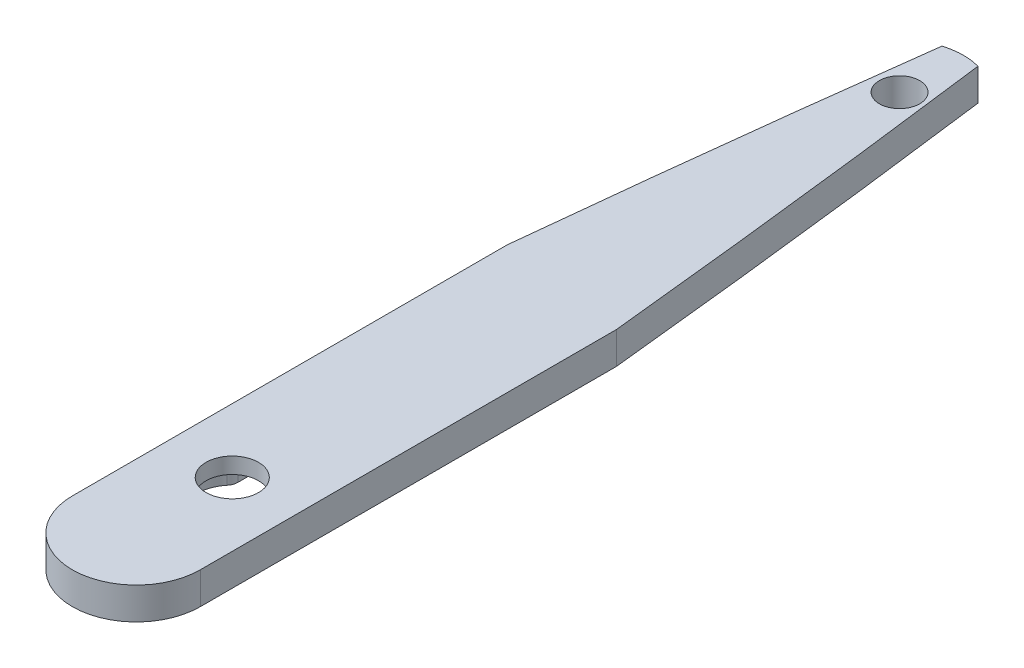
from build123d import *

# Parameters (mm, degrees)
SKETCH1_W           = 15
SKETCH1_H           = 45
BOSS_EXTRUDE1_DEPTH = 2.2
SKETCH1_3_W         = 20
SKETCH1_3_H         = 50
SKETCH1_3_W_2       = 15
SKETCH1_3_H_2       = 45
BOSS_EXTRUDE2_DEPTH = 2.5
SKETCH1_4_W         = 20
SKETCH1_4_H         = 50
SKETCH1_4_R         = 4.1
BOSS_EXTRUDE3_DEPTH = 2.5
FILLET1_R           = 2
SKETCH1_5_R         = 3.15
BOSS_EXTRUDE4_DEPTH = 2.5
FILLET2_R           = 10
SKETCH2_R           = 3.15
CUT_EXTRUDE1_DEPTH  = 4
SKETCH3_OUTSIDE_W   = 50.164
SKETCH3_OUTSIDE_H   = 169.464
CUT_EXTRUDE2_DEPTH  = 115.845504919


with BuildPart() as part:
    # Sketch1 → Boss-Extrude1 (new body)
    with BuildSketch(Plane(origin=(0, 0, 0), x_dir=(1, 0, 0), z_dir=(0, 1, 0))):
        Rectangle(SKETCH1_W, SKETCH1_H)
        with BuildLine():
            ThreePointArc((-3.894544437, -4.023993492), (-5.599998379, 0.004260474), (-3.88841703, 4.029914763))
            Line((-3.88841703, 4.029914763), (-3.88841703, 8.505312122))
            ThreePointArc((-3.88841703, 8.505312122), (-3.870707724, 8.925763598), (-3.817705253, 9.343236712))
            Line((-3.817705253, 9.343236712), (-2.664584371, 16.126741161))
            ThreePointArc((-2.664584371, 16.126741161), (-2.610617779, 16.555799687), (-2.593926654, 16.987916591))
            ThreePointArc((-2.593926654, 16.987916591), (0, 19.6), (2.606045235, 17.000007028))
            ThreePointArc((2.606045235, 17.000007028), (2.623754541, 16.579555552), (2.676757012, 16.162082438))
            Line((2.676757012, 16.162082438), (3.829877895, 9.378577989))
            ThreePointArc((3.829877895, 9.378577989), (3.882880366, 8.961104875), (3.900589672, 8.540653399))
            Line((3.900589672, 8.540653399), (3.900589672, 4.018133922))
            ThreePointArc((3.900589672, 4.018133922), (5.157678846, 2.181364004), (5.6, 0))
            ThreePointArc((5.6, 0), (5.156037667, -2.185240393), (3.894544437, -4.023993492))
            Line((3.894544437, -4.023993492), (3.894544437, -8.540646372))
            ThreePointArc((3.894544437, -8.540646372), (3.876835131, -8.961097847), (3.82383266, -9.378570962))
            Line((3.82383266, -9.378570962), (2.670711777, -16.16207541))
            ThreePointArc((2.670711777, -16.16207541), (2.617709306, -16.579548524), (2.6, -17))
            ThreePointArc((2.6, -17), (0, -19.6), (-2.6, -17))
            ThreePointArc((-2.6, -17), (-2.617709306, -16.579548524), (-2.670711777, -16.16207541))
            Line((-2.670711777, -16.16207541), (-3.82383266, -9.378570962))
            ThreePointArc((-3.82383266, -9.378570962), (-3.876835131, -8.961097847), (-3.894544437, -8.540646372))
            Line((-3.894544437, -8.540646372), (-3.894544437, -4.023993492))
        make_face(mode=Mode.SUBTRACT)
    extrude(amount=-BOSS_EXTRUDE1_DEPTH)

    # Sketch1<3> → Boss-Extrude2 (add)
    # profile 1 of 2: a face of its own
    with BuildSketch(Plane(origin=(0, 0, 0), x_dir=(1, 0, 0), z_dir=(0, 1, 0))):
        Rectangle(SKETCH1_3_W, SKETCH1_3_H)
        Rectangle(SKETCH1_3_W_2, SKETCH1_3_H_2, mode=Mode.SUBTRACT)
    # profile 2 of 2: a face of its own
    with BuildSketch(Plane(origin=(0, 0, 0), x_dir=(1, 0, 0), z_dir=(0, 1, 0))):
        Rectangle(SKETCH1_3_W_2, SKETCH1_3_H_2)
        with BuildLine():
            ThreePointArc((-3.894544437, -4.023993492), (-5.599998379, 0.004260474), (-3.88841703, 4.029914763))
            Line((-3.88841703, 4.029914763), (-3.88841703, 8.505312122))
            ThreePointArc((-3.88841703, 8.505312122), (-3.870707724, 8.925763598), (-3.817705253, 9.343236712))
            Line((-3.817705253, 9.343236712), (-2.664584371, 16.126741161))
            ThreePointArc((-2.664584371, 16.126741161), (-2.610617779, 16.555799687), (-2.593926654, 16.987916591))
            ThreePointArc((-2.593926654, 16.987916591), (0, 19.6), (2.606045235, 17.000007028))
            ThreePointArc((2.606045235, 17.000007028), (2.623754541, 16.579555552), (2.676757012, 16.162082438))
            Line((2.676757012, 16.162082438), (3.829877895, 9.378577989))
            ThreePointArc((3.829877895, 9.378577989), (3.882880366, 8.961104875), (3.900589672, 8.540653399))
            Line((3.900589672, 8.540653399), (3.900589672, 4.018133922))
            ThreePointArc((3.900589672, 4.018133922), (5.157678846, 2.181364004), (5.6, 0))
            ThreePointArc((5.6, 0), (5.156037667, -2.185240393), (3.894544437, -4.023993492))
            Line((3.894544437, -4.023993492), (3.894544437, -8.540646372))
            ThreePointArc((3.894544437, -8.540646372), (3.876835131, -8.961097847), (3.82383266, -9.378570962))
            Line((3.82383266, -9.378570962), (2.670711777, -16.16207541))
            ThreePointArc((2.670711777, -16.16207541), (2.617709306, -16.579548524), (2.6, -17))
            ThreePointArc((2.6, -17), (0, -19.6), (-2.6, -17))
            ThreePointArc((-2.6, -17), (-2.617709306, -16.579548524), (-2.670711777, -16.16207541))
            Line((-2.670711777, -16.16207541), (-3.82383266, -9.378570962))
            ThreePointArc((-3.82383266, -9.378570962), (-3.876835131, -8.961097847), (-3.894544437, -8.540646372))
            Line((-3.894544437, -8.540646372), (-3.894544437, -4.023993492))
        make_face(mode=Mode.SUBTRACT)
    extrude(amount=-BOSS_EXTRUDE2_DEPTH)

    # Sketch1<4> → Boss-Extrude3 (add)
    with BuildSketch(Plane(origin=(0, 0, 0), x_dir=(1, 0, 0), z_dir=(0, 1, 0))):
        Rectangle(SKETCH1_4_W, SKETCH1_4_H)
        with Locations(Location((0, 0, 0), (0, 0, 270))):
            Circle(SKETCH1_4_R, mode=Mode.SUBTRACT)
    extrude(amount=BOSS_EXTRUDE3_DEPTH)

    # Fillet1
    fillet1_edges = [part.edges().sort_by_distance(p)[0] for p in [
        (-3.88841703, -1.25, -4.029914763),
        (-3.894544437, -1.25, 4.023993492),
        (3.894544437, -1.25, 4.023993492),
        (3.900589672, -1.25, -4.018133922),
    ]]
    fillet(fillet1_edges, radius=FILLET1_R)

    # Sketch1<5> → Boss-Extrude4 (add, symmetric)
    with BuildSketch(Plane(origin=(0, 0, 0), x_dir=(1, 0, 0), z_dir=(0, 1, 0))):
        with BuildLine():
            ThreePointArc((-10, 104.3), (0, 114.3), (10, 104.3))
            Line((10, 104.3), (10, 25))
            Line((10, 25), (-10, 25))
            Line((-10, 25), (-10, 104.3))
        make_face()
        with Locations(Location((0, 104.3, 0), (0, 0, 270))):
            Circle(SKETCH1_5_R, mode=Mode.SUBTRACT)
    extrude(amount=BOSS_EXTRUDE4_DEPTH, both=True)

    # Fillet2
    fillet2_edges = [part.edges().sort_by_distance(p)[0] for p in [
        (10, 0, 25),
        (-10, 0, 25),
    ]]
    fillet(fillet2_edges, radius=FILLET2_R - 0.0001)  # a hair under: the kernel refuses the full size

    # Sketch2 → Cut-Extrude1 (cut)
    # profile 1 of 8: a face of its own
    with BuildSketch(Plane.XZ.offset(2.5)):
        with Locations(Location((0, -104.3, 0), (0, 0, 90))):
            Circle(SKETCH2_R)
    # profile 2 of 8: a face of its own
    with BuildSketch(Plane.XZ.offset(2.5)):
        Polygon((5.973502692, -72.744870683), (-2.986751346, -67.571665602), (-2.986751346, -77.918075763), align=None)
        Polygon((5.773502692, -72.744870683), (-2.886751346, -67.744870683), (-2.886751346, -77.744870683), align=None, mode=Mode.SUBTRACT)
    # profile 3 of 8: a face of its own
    with BuildSketch(Plane.XZ.offset(2.5)):
        Polygon((5.973502692, -56.744870683), (-2.986751346, -51.571665602), (-2.986751346, -61.918075763), align=None)
        Polygon((5.773502692, -56.744870683), (-2.886751346, -51.744870683), (-2.886751346, -61.744870683), align=None, mode=Mode.SUBTRACT)
    # profile 4 of 8: a face of its own
    with BuildSketch(Plane.XZ.offset(2.5)):
        Polygon((5.973502692, -40.744870683), (-2.986751346, -35.571665602), (-2.986751346, -45.918075763), align=None)
        Polygon((5.773502692, -40.744870683), (-2.886751346, -35.744870683), (-2.886751346, -45.744870683), align=None, mode=Mode.SUBTRACT)
    # profile 5 of 8: a face of its own
    with BuildSketch(Plane.XZ.offset(2.5)):
        Polygon((5.973502692, -24.744870683), (-2.986751346, -19.571665602), (-2.986751346, -29.918075763), align=None)
        Polygon((5.773502692, -24.744870683), (-2.886751346, -19.744870683), (-2.886751346, -29.744870683), align=None, mode=Mode.SUBTRACT)
    # profile 6 of 8: a face of its own
    with BuildSketch(Plane.XZ.offset(2.5)):
        Polygon((-3.086751346, -64.744870683), (5.873502692, -59.571665602), (5.873502692, -69.918075763), align=None)
        Polygon((5.773502692, -69.744870683), (-2.886751346, -64.744870683), (5.773502692, -59.744870683), align=None, mode=Mode.SUBTRACT)
    # profile 7 of 8: a face of its own
    with BuildSketch(Plane.XZ.offset(2.5)):
        Polygon((-3.086751346, -48.744870683), (5.873502692, -43.571665602), (5.873502692, -53.918075763), align=None)
        Polygon((5.773502692, -53.744870683), (-2.886751346, -48.744870683), (5.773502692, -43.744870683), align=None, mode=Mode.SUBTRACT)
    # profile 8 of 8: a face of its own
    with BuildSketch(Plane.XZ.offset(2.5)):
        Polygon((-3.086751346, -32.744870683), (5.873502692, -27.571665602), (5.873502692, -37.918075763), align=None)
        Polygon((5.773502692, -37.744870683), (-2.886751346, -32.744870683), (5.773502692, -27.744870683), align=None, mode=Mode.SUBTRACT)
    extrude(amount=-CUT_EXTRUDE1_DEPTH, mode=Mode.SUBTRACT)

    # Sketch3 outside → Cut-Extrude2 (cut, through all)
    with BuildSketch(Plane.XZ.offset(2.5)):
        with Locations((0, -44.65)):
            Rectangle(SKETCH3_OUTSIDE_W, SKETCH3_OUTSIDE_H)
        with BuildLine():
            Line((10, -50.039570793), (10, 15))
            ThreePointArc((10, 15), (7.071067812, 22.071067812), (0, 25))
            ThreePointArc((0, 25), (-7.071067812, 22.071067812), (-10, 15))
            Line((-10, 15), (-10, -52.98511299))
            add(Edge.make_bspline(
                [(-10, -52.98511299), (-9.762519387, -55.301766927), (-9.181616668, -60.883726896), (-8.247873188, -69.548054482), (-7.214243072, -78.778305336), (-6.212768932, -87.409094774), (-5.257188729, -95.387335619), (-4.359016041, -102.663786405), (-3.588431315, -108.744280233), (-3.115741639, -112.393973299), (-2.923840172, -113.863009916)],
                knots=[0.870609711, 0.870609711, 0.870609711, 0.870609711, 0.882031045, 0.898133678, 0.913348978, 0.927582736, 0.940746445, 0.952757055, 0.963540146, 0.970806103, 0.970806103, 0.970806103, 0.970806103], degree=3))
            ThreePointArc((-2.923840172, -113.863009916), (-0.162206263, -114.29868437), (2.612106393, -113.952818251))
            add(Edge.make_bspline(
                [(2.612106393, -113.952818251), (2.807985487, -112.453854191), (3.284635603, -108.774231255), (4.059016041, -102.663786405), (4.957188729, -95.387335619), (5.912768932, -87.409094774), (6.914243072, -78.778305336), (7.947873188, -69.548054482), (8.987364419, -59.902479724), (9.66619931, -53.338446984), (10, -50.039570793)],
                knots=[0.029045831, 0.029045831, 0.029045831, 0.029045831, 0.036459854, 0.047242945, 0.059253555, 0.072417264, 0.086651022, 0.101866322, 0.117968955, 0.134230571, 0.134230571, 0.134230571, 0.134230571], degree=3))
        make_face(mode=Mode.SUBTRACT)
    extrude(amount=-CUT_EXTRUDE2_DEPTH, mode=Mode.SUBTRACT)


solid = part.part
